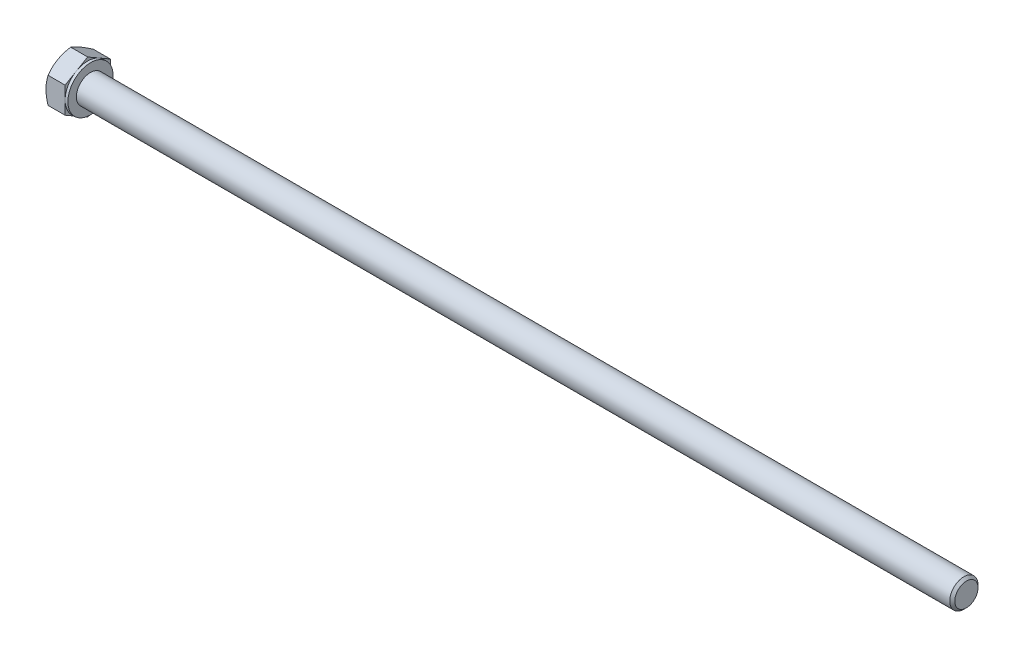
from build123d import *

# Parameters (mm, degrees)
BASEHEAD_DEPTH = 3.875
SKETCH4_W      = 0.5
SKETCH4_H      = 10.618802154


# Read off the part's stored shape, not the designer's step: HeadChamfer
with BuildPart() as part:
    # Sketch1 → BaseHead (new body)
    with BuildSketch(Plane(origin=(0, 0, 0), x_dir=(0, 0, -1), z_dir=(1, 0, 0))):
        Polygon((4, 2.309401077), (4, -2.309401077), (0, -4.618802154), (-4, -2.309401077), (-4, 2.309401077), (0, 4.618802154), align=None)
    extrude(amount=BASEHEAD_DEPTH)

    # HeadChamfer outline → HeadChamfer (revolve, cut)
    with BuildSketch(Plane.YX):
        Polygon((4.618802148, 0.357265587), (3.999999382, -3.57e-07), (4.618802154, -3.57e-07), align=None)
    revolve(axis=Axis((0, 0, 0), (1, 0, 0)), mode=Mode.SUBTRACT)

    # HeadChamfer 2 outline → HeadChamfer 2 (revolve)
    with BuildSketch(Plane.YX):
        Polygon((2.5, 3.875), (2.5, 158.43), (2.055, 158.875), (0, 158.875), (0, 3.875), align=None)
    revolve(axis=Axis((0, 0, 0), (1, 0, 0)))

    # Sketch4 → BearingFace (revolve, cut)
    with BuildSketch(Plane.XY, mode=Mode.PRIVATE) as bearingface_sk:
        with Locations((3.625, 9.309401077)):
            Rectangle(SKETCH4_W, SKETCH4_H)
    revolve(bearingface_sk.sketch.rotate(Axis((0, 0, 0), (1, 0, 0)), 90), axis=Axis((0, 0, 0), (1, 0, 0)), mode=Mode.SUBTRACT)


solid = part.part
